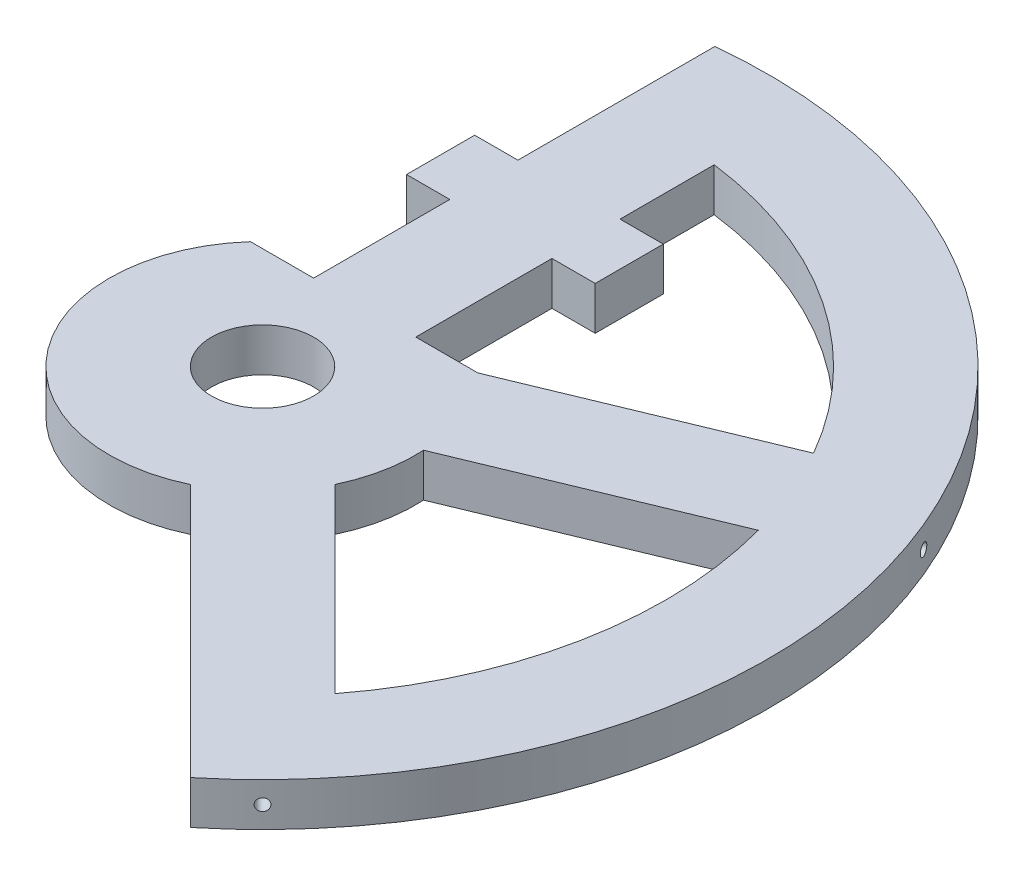
from build123d import *

# Parameters (mm, degrees)
SKETCH1_R           = 7.5
BOSS_EXTRUDE1_DEPTH = 3.175
CIRPATTERN1_COUNT   = 3
CIRPATTERN1_ANGLE   = 135


with BuildPart() as part:
    # Sketch1 → Boss-Extrude1 (new, symmetric)
    with BuildSketch(Plane(origin=(0, 0, 0), x_dir=(1, 0, 0), z_dir=(0, 1, 0))):
        with BuildLine():
            Line((-13.85, 45), (-13.85, 35))
            Line((-13.85, 35), (-7.5, 35))
            Line((-7.5, 35), (-7.5, 15))
            Line((-7.5, 15), (-16.770509831, 15))
            ThreePointArc((-16.770509831, 15), (-18.002512666, -13.496649128), (9.696699141, -20.303300859))
            Line((9.696699141, -20.303300859), (46.966384428, -57.572986146))
            ThreePointArc((46.966384428, -57.572986146), (71.03695878, -21.777063329), (71.163760724, 21.359053339))
            ThreePointArc((71.163760724, 21.359053339), (68.644249266, 28.433379025), (65.423509239, 35.217246327))
            ThreePointArc((65.423509239, 35.217246327), (34.832006114, 65.629424423), (-7.5, 73.920497834))
            Line((-7.5, 73.920497834), (-7.5, 45))
            Line((-7.5, 45), (-13.85, 45))
        make_face()
        Circle(SKETCH1_R, mode=Mode.SUBTRACT)
        with BuildLine():
            Line((46.898012061, -36.291410343), (20.303300859, -9.696699141))
            ThreePointArc((20.303300859, -9.696699141), (22.067668809, -4.389532245), (22.468570216, 1.188845008))
            Line((22.468570216, 1.188845008), (57.216234934, 15.581798996))
            ThreePointArc((57.216234934, 15.581798996), (58.160567128, -11.568856096), (46.898012061, -36.291410343))
        make_face(mode=Mode.SUBTRACT)
        with BuildLine():
            Line((16.614758962, 15), (7.5, 15))
            Line((7.5, 15), (7.5, 35))
            Line((7.5, 35), (13.85, 35))
            Line((13.85, 35), (13.85, 45))
            Line((13.85, 45), (7.5, 45))
            Line((7.5, 45), (7.5, 58.823804705))
            ThreePointArc((7.5, 58.823804705), (32.945314818, 49.30614801), (51.475983449, 29.439991983))
            Line((51.475983449, 29.439991983), (16.72831873, 15.047037996))
            Line((16.72831873, 15.047037996), (16.614758962, 15))
        make_face(mode=Mode.SUBTRACT)
    extrude(amount=BOSS_EXTRUDE1_DEPTH, both=True)

    # Sketch5 → M2.2x0.45 Tapped Hole1 (revolve, cut)
    with BuildSketch(Plane(origin=(0, 0, -74.3), x_dir=(0, 1, 0), z_dir=(1, 0, 0))):
        Polygon((0, 0), (0, 10.525753042), (0.875, 10), (0.875, 0), align=None)
    m2_2x0_45_tapped_hole1 = revolve(axis=Axis((0, 0, -80.65), (0, 0, 1)), mode=Mode.SUBTRACT)

    # CirPattern1: M2.2x0.45 Tapped Hole1 ×3 about axis
    cirpattern1_axis = Axis((0, 3.175, 0), (0, -1, 0))
    for i in range(1, CIRPATTERN1_COUNT):
        add(m2_2x0_45_tapped_hole1.rotate(cirpattern1_axis, i * CIRPATTERN1_ANGLE / (CIRPATTERN1_COUNT - 1)), mode=Mode.SUBTRACT)


solid = part.part
